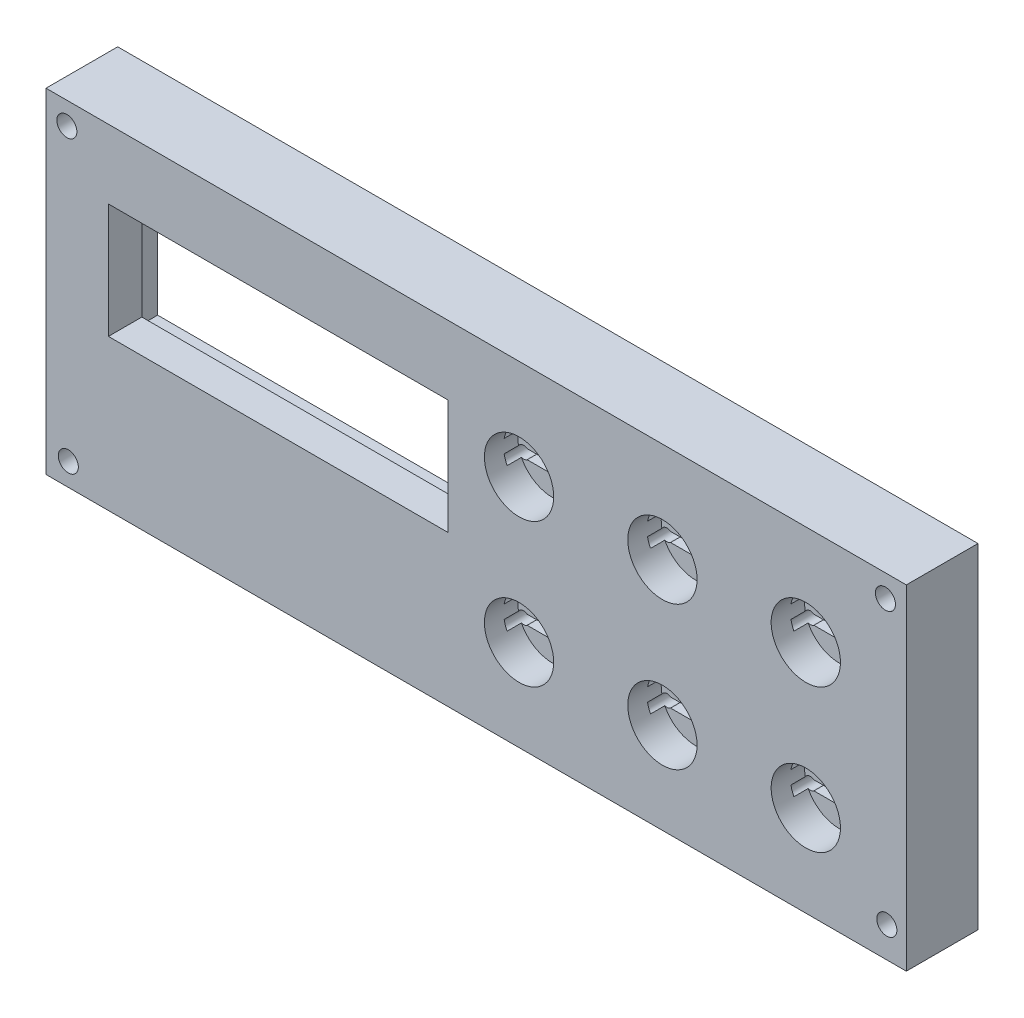
from build123d import *

# Parameters (mm, degrees)
SKETCH_1_W               = 180
SKETCH_1_H               = 70
EXTRUDE_1_DEPTH          = 15
SKETCH_2_R               = 2.1
SKETCH_2_W               = 71
SKETCH_2_H               = 24
CUT_EXTRUDE_1_DEPTH      = 194.713706278
SKETCH_5_W               = 80.4
SKETCH_5_H               = 36
SKETCH_5_W_2             = 71
SKETCH_5_H_2             = 24
CUT_EXTRUDE_3_DEPTH      = 8
SKETCH_6_W               = 4.7
SKETCH_6_H               = 24
CUT_EXTRUDE_4_DEPTH      = 3
SKETCH_7_R               = 7.25
CUT_EXTRUDE_5_DEPTH      = 7
CUT_EXTRUDE_6_DEPTH      = 4.2
CUT_EXTRUDE_7_DEPTH      = 3
CUT_EXTRUDE_7_DEPTH_BACK = 194.297697865
SKETCH_9_R               = 1.25
CUT_EXTRUDE_8_DEPTH      = 13
CUT_EXTRUDE_10_DEPTH     = 12


with BuildPart() as part:
    # 草图1 → 凸台-拉伸1 (new body)
    with BuildSketch(Plane.XY):
        with Locations((90, 35)):
            Rectangle(SKETCH_1_W, SKETCH_1_H)
    extrude(amount=EXTRUDE_1_DEPTH)

    # 草图2 → 切除-拉伸1 (cut, through all)
    with BuildSketch(Plane.XY.offset(15)):
        with Locations((4.367458012, 65.325340213)):
            Circle(SKETCH_2_R)
        with Locations((175.632541988, 65.325340213)):
            Circle(SKETCH_2_R)
        with Locations((175.923124979, 6.408564886)):
            Circle(SKETCH_2_R)
        with Locations((4.666373031, 4.719215478)):
            Circle(SKETCH_2_R)
        with Locations((48.558725391, 43.555444336)):
            Rectangle(SKETCH_2_W, SKETCH_2_H)
    extrude(amount=-CUT_EXTRUDE_1_DEPTH, mode=Mode.SUBTRACT)

    # 草图5 → 切除-拉伸3 (cut)
    with BuildSketch(Plane(origin=(0, 0, 0), x_dir=(-1, 0, 0), z_dir=(0, 0, -1))):
        with Locations((-48.558725391, 43.555444336)):
            Rectangle(SKETCH_5_W, SKETCH_5_H)
        with Locations((-48.558725391, 43.555444336)):
            Rectangle(SKETCH_5_W_2, SKETCH_5_H_2, mode=Mode.SUBTRACT)
    extrude(amount=-CUT_EXTRUDE_3_DEPTH, mode=Mode.SUBTRACT)

    # 草图6 → 切除-拉伸4 (cut)
    with BuildSketch(Plane(origin=(0, 0, 8), x_dir=(-1, 0, 0), z_dir=(0, 0, -1))):
        with Locations((-86.408725391, 43.555444336)):
            Rectangle(SKETCH_6_W, SKETCH_6_H)
    extrude(amount=-CUT_EXTRUDE_4_DEPTH, mode=Mode.SUBTRACT)

    # 草图7 → 切除-拉伸5 (cut)
    with BuildSketch(Plane.XY.offset(15)):
        with Locations((98.972752909, 49.067651319)):
            Circle(SKETCH_7_R)
        with Locations((128.972752909, 49.067651319)):
            Circle(SKETCH_7_R)
        with Locations((158.972752909, 49.067651319)):
            Circle(SKETCH_7_R)
        with Locations((128.972752909, 19.067651319)):
            Circle(SKETCH_7_R)
        with Locations((158.972752909, 19.067651319)):
            Circle(SKETCH_7_R)
        with Locations((98.972752909, 19.067651319)):
            Circle(SKETCH_7_R)
    extrude(amount=-CUT_EXTRUDE_5_DEPTH, mode=Mode.SUBTRACT)

    # 草图8 → 切除-拉伸6 (cut)
    with BuildSketch(Plane.XY.offset(8)):
        Polygon((95.922752909, 48.017651319), (92.922752909, 48.017651319), (92.922752909, 46.017651319), (95.922752909, 46.017651319), (102.022752909, 46.017651319), (105.022752909, 46.017651319), (105.022752909, 48.017651319), (102.022752909, 48.017651319), (102.022752909, 50.117651319), (105.022752909, 50.117651319), (105.022752909, 52.117651319), (102.022752909, 52.117651319), (95.922752909, 52.117651319), (92.922752909, 52.117651319), (92.922752909, 50.117651319), (95.922752909, 50.117651319), align=None)
        Polygon((125.922752909, 52.117651319), (132.022752909, 52.117651319), (135.022752909, 52.117651319), (135.022752909, 50.117651319), (132.022752909, 50.117651319), (132.022752909, 48.017651319), (135.022752909, 48.017651319), (135.022752909, 46.017651319), (132.022752909, 46.017651319), (125.922752909, 46.017651319), (122.922752909, 46.017651319), (122.922752909, 48.017651319), (125.922752909, 48.017651319), (125.922752909, 50.117651319), (122.922752909, 50.117651319), (122.922752909, 52.117651319), align=None)
        Polygon((155.922752909, 52.117651319), (162.022752909, 52.117651319), (165.022752909, 52.117651319), (165.022752909, 50.117651319), (162.022752909, 50.117651319), (162.022752909, 48.017651319), (165.022752909, 48.017651319), (165.022752909, 46.017651319), (162.022752909, 46.017651319), (155.922752909, 46.017651319), (152.922752909, 46.017651319), (152.922752909, 48.017651319), (155.922752909, 48.017651319), (155.922752909, 50.117651319), (152.922752909, 50.117651319), (152.922752909, 52.117651319), align=None)
        Polygon((125.922752909, 22.117651319), (132.022752909, 22.117651319), (135.022752909, 22.117651319), (135.022752909, 20.117651319), (132.022752909, 20.117651319), (132.022752909, 18.017651319), (135.022752909, 18.017651319), (135.022752909, 16.017651319), (132.022752909, 16.017651319), (125.922752909, 16.017651319), (122.922752909, 16.017651319), (122.922752909, 18.017651319), (125.922752909, 18.017651319), (125.922752909, 20.117651319), (122.922752909, 20.117651319), (122.922752909, 22.117651319), align=None)
        Polygon((155.922752909, 22.117651319), (162.022752909, 22.117651319), (165.022752909, 22.117651319), (165.022752909, 20.117651319), (162.022752909, 20.117651319), (162.022752909, 18.017651319), (165.022752909, 18.017651319), (165.022752909, 16.017651319), (162.022752909, 16.017651319), (155.922752909, 16.017651319), (152.922752909, 16.017651319), (152.922752909, 18.017651319), (155.922752909, 18.017651319), (155.922752909, 20.117651319), (152.922752909, 20.117651319), (152.922752909, 22.117651319), align=None)
        Polygon((95.922752909, 22.117651319), (102.022752909, 22.117651319), (105.022752909, 22.117651319), (105.022752909, 20.117651319), (102.022752909, 20.117651319), (102.022752909, 18.017651319), (105.022752909, 18.017651319), (105.022752909, 16.017651319), (102.022752909, 16.017651319), (95.922752909, 16.017651319), (92.922752909, 16.017651319), (92.922752909, 18.017651319), (95.922752909, 18.017651319), (95.922752909, 20.117651319), (92.922752909, 20.117651319), (92.922752909, 22.117651319), align=None)
    extrude(amount=-CUT_EXTRUDE_6_DEPTH, mode=Mode.SUBTRACT)

    # 草图9 → 切除-拉伸7 (cut, two sides: drawn at the far end of the back side and taken through both)
    with BuildSketch(Plane.XY.offset(8).offset(-CUT_EXTRUDE_7_DEPTH_BACK)):
        with Locations((92.922752909, 51.117651319)):
            Circle(SKETCH_9_R)
        with Locations((105.022752909, 51.117651319)):
            Circle(SKETCH_9_R)
        with Locations((105.022752909, 47.017651319)):
            Circle(SKETCH_9_R)
        with Locations((92.922752909, 47.017651319)):
            Circle(SKETCH_9_R)
        with Locations((122.922752909, 51.117651319)):
            Circle(SKETCH_9_R)
        with Locations((135.022752909, 51.117651319)):
            Circle(SKETCH_9_R)
        with Locations((135.022752909, 47.017651319)):
            Circle(SKETCH_9_R)
        with Locations((122.922752909, 47.017651319)):
            Circle(SKETCH_9_R)
        with Locations((152.922752909, 51.117651319)):
            Circle(SKETCH_9_R)
        with Locations((165.022752909, 51.117651319)):
            Circle(SKETCH_9_R)
        with Locations((165.022752909, 47.017651319)):
            Circle(SKETCH_9_R)
        with Locations((152.922752909, 47.017651319)):
            Circle(SKETCH_9_R)
        with Locations((122.922752909, 21.117651319)):
            Circle(SKETCH_9_R)
        with Locations((135.022752909, 21.117651319)):
            Circle(SKETCH_9_R)
        with Locations((135.022752909, 17.017651319)):
            Circle(SKETCH_9_R)
        with Locations((122.922752909, 17.017651319)):
            Circle(SKETCH_9_R)
        with Locations((152.922752909, 21.117651319)):
            Circle(SKETCH_9_R)
        with Locations((165.022752909, 21.117651319)):
            Circle(SKETCH_9_R)
        with Locations((165.022752909, 17.017651319)):
            Circle(SKETCH_9_R)
        with Locations((152.922752909, 17.017651319)):
            Circle(SKETCH_9_R)
        with Locations((92.922752909, 21.117651319)):
            Circle(SKETCH_9_R)
        with Locations((105.022752909, 21.117651319)):
            Circle(SKETCH_9_R)
        with Locations((105.022752909, 17.017651319)):
            Circle(SKETCH_9_R)
        with Locations((92.922752909, 17.017651319)):
            Circle(SKETCH_9_R)
    extrude(amount=CUT_EXTRUDE_7_DEPTH + CUT_EXTRUDE_7_DEPTH_BACK, mode=Mode.SUBTRACT)

    # 草图10 → 切除-拉伸8 (cut)
    with BuildSketch(Plane(origin=(0, 0, 0), x_dir=(-1, 0, 0), z_dir=(0, 0, -1))):
        Polygon((-171.002219313, 67.469244028), (-9.134493294, 67.469244028), (-9.134493294, 64.32485408), (-92.255758006, 64.32485408), (-92.255758006, 58.58292461), (-168.404679791, 58.58292461), (-168.404679791, 10.323374538), (-88.564517632, 10.323374538), (-88.564517632, 21.807233479), (-6.536953771, 21.807233479), (-6.536953771, 60.633613707), (-3.11913861, 60.633613707), (-3.11913861, 21.807233479), (-3.11913861, 10.323374538), (-10.228194145, 10.323374538), (-10.228194145, 3.214319004), (-171.002219313, 3.214319004), (-171.002219313, 10.323374538), (-177.154286602, 10.323374538), (-177.154286602, 58.58292461), (-171.002219313, 58.58292461), align=None)
    extrude(amount=-CUT_EXTRUDE_8_DEPTH, mode=Mode.SUBTRACT)

    # 草图11 → 切除-拉伸10 (cut)
    with BuildSketch(Plane(origin=(0, 0, 0), x_dir=(-1, 0, 0), z_dir=(0, 0, -1))):
        Polygon((-148.164518432, 58.58292461), (-139.298967681, 58.58292461), (-139.298967681, 39.728582059), (-118.284328862, 39.728582059), (-118.284328862, 58.58292461), (-109.199875623, 58.58292461), (-109.199875623, 39.728582059), (-91.030969144, 39.728582059), (-91.030969144, 28.67400643), (-109.199875623, 28.67400643), (-109.199875623, 10.323374538), (-118.284328862, 10.323374538), (-118.284328862, 28.67400643), (-139.298967681, 28.67400643), (-139.298967681, 10.323374538), (-148.164518432, 10.323374538), (-148.164518432, 28.67400643), (-168.404679791, 28.67400643), (-168.404679791, 39.728582059), (-148.164518432, 39.728582059), align=None)
    extrude(amount=-CUT_EXTRUDE_10_DEPTH, mode=Mode.SUBTRACT)


solid = part.part
